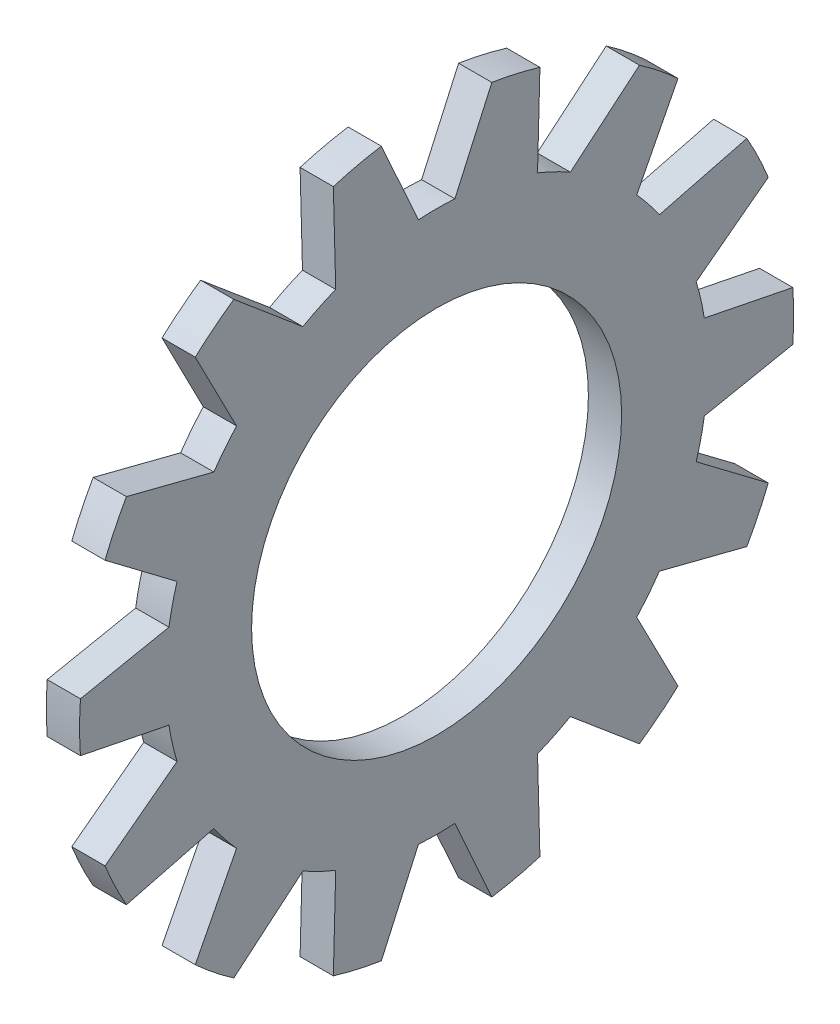
from build123d import *

# Parameters (mm, degrees)
SECSKE_W      = 0.5842
SECSKE_H      = 3.0226
EXTCUT_DEPTH  = 9.891705265
EXTCUTS_COUNT = 14
EXTCUTS_ANGLE = 334.285714286


with BuildPart() as part:
    # SecSke → Body (revolve)
    with BuildSketch(Plane.XY):
        with Locations((-0.2921, 4.7625)):
            Rectangle(SECSKE_W, SECSKE_H)
    revolve(axis=Axis((-34.925, 0, 0), (1, 0, 0)))

    # ExtCutSke → ExtCut (cut, through all)
    with BuildSketch(Plane(origin=(0, 0, 0), x_dir=(0, 0, -1), z_dir=(1, 0, 0))):
        with BuildLine():
            Line((-1.103445571, 6.494415476), (-0.320368639, 4.751712342))
            ThreePointArc((-0.320368639, 4.751712342), (0, 4.7625), (0.320368639, 4.751712342))
            Line((0.320368639, 4.751712342), (1.103445571, 6.494415476))
            ThreePointArc((1.103445571, 6.494415476), (0, 6.58749), (-1.103445571, 6.494415476))
        make_face()
    extcut = extrude(amount=-EXTCUT_DEPTH, mode=Mode.SUBTRACT)

    # ExtCuts: ExtCut ×14 about axis
    extcuts_axis = Axis((-34.925, 0, 0), (1, 0, 0))
    for i in range(1, EXTCUTS_COUNT):
        add(extcut.rotate(extcuts_axis, i * EXTCUTS_ANGLE / (EXTCUTS_COUNT - 1)), mode=Mode.SUBTRACT)


solid = part.part
